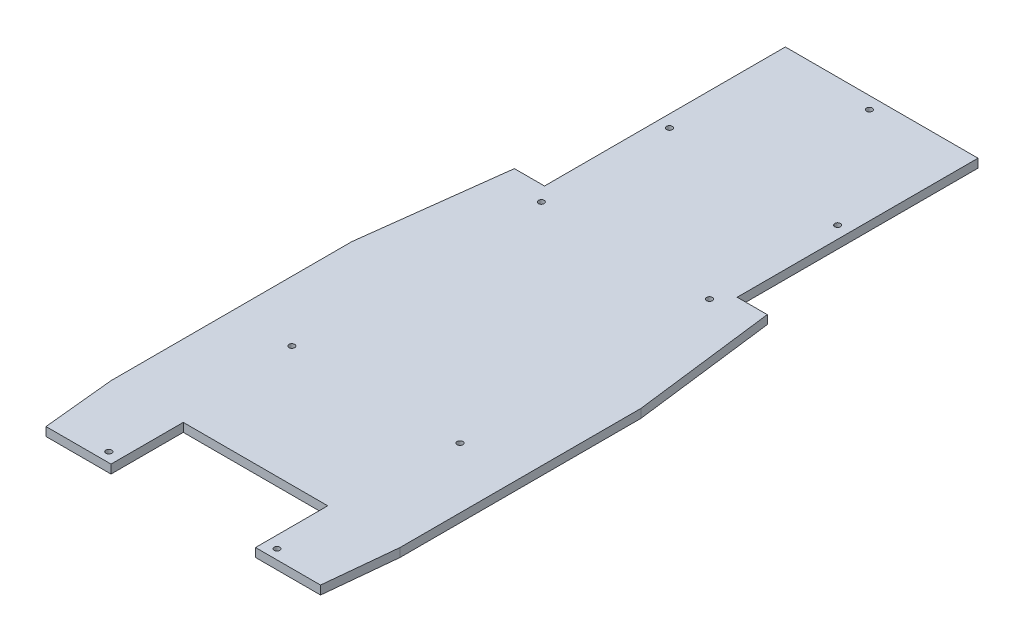
from build123d import *

# Parameters (mm, degrees)
BOSS_EXTRUDE1_DEPTH               = 9
F_6_0_6_DIAMETER_HOLE1_D          = 6
F_6_0_6_DIAMETER_HOLE3_D          = 6
F_6_0_6_DIAMETER_HOLE3_DEPTH      = 34.5
F_6_0_6_DIAMETER_HOLE3_TIP        = 1.802581857
F_6_0_6_DIAMETER_HOLE4_AT_2_COUNT = 2
F_6_0_6_DIAMETER_HOLE4_AT_2_PITCH = 246
F_6_0_6_DIAMETER_HOLE5_AT_2_COUNT = 2
F_6_0_6_DIAMETER_HOLE5_AT_2_PITCH = 56
F_6_0_6_DIAMETER_HOLE5_AT_3_COUNT = 2
F_6_0_6_DIAMETER_HOLE5_AT_3_PITCH = 164
F_6_0_6_DIAMETER_HOLE5_AT_4_COUNT = 2
F_6_0_6_DIAMETER_HOLE5_AT_4_PITCH = 173.297432179
CUT_EXTRUDE1_DEPTH                = 547.082411363


with BuildPart() as part:
    # Sketch1 → Boss-Extrude1 (new body)
    with BuildSketch(Plane(origin=(0, 0, 0), x_dir=(1, 0, 0), z_dir=(0, 1, 0))):
        Polygon((-150, -125), (-150, 125), (-100, 525), (100, 525), (150, 125), (150, -125), (125, -375), (-125, -375), align=None)
    extrude(amount=BOSS_EXTRUDE1_DEPTH)

    # Ø6.0 (6) Diameter Hole1 (through all)
    with Locations(Plane(origin=(0, 9, -512.3), x_dir=(0, 0, 1), z_dir=(0, 1, 0))):
        with Locations((0, 0), (120.3, -87.3), (253.3, -87.3), (253.3, 87.3), (120.3, 87.3), (512.3, 87.3), (512.3, -87.3), (702.3, -87.3), (702.3, 87.3), (799.1, 0)):
            Hole(F_6_0_6_DIAMETER_HOLE1_D / 2)

    # Ø6.0 (6) Diameter Hole3
    with Locations(Plane(origin=(0, 0, -512.3), x_dir=(0, 0, -1), z_dir=(0, -1, 0))):
        with Locations((0, 0), (-120.3, 87.3), (-120.3, -87.3), (-253.3, -87.3), (-253.3, 87.3), (-512.3, 87.3), (-512.3, -87.3), (-702.3, -87.3), (-702.3, 87.3), (-799.1, 0)):
            Hole(F_6_0_6_DIAMETER_HOLE3_D / 2, depth=F_6_0_6_DIAMETER_HOLE3_DEPTH)
            with Locations((0, 0, -(F_6_0_6_DIAMETER_HOLE3_DEPTH + F_6_0_6_DIAMETER_HOLE3_TIP / 2))):  # 118° drill point
                Cone(0, F_6_0_6_DIAMETER_HOLE3_D / 2, F_6_0_6_DIAMETER_HOLE3_TIP, mode=Mode.SUBTRACT)

    # Sketch10 → Ø6.0 (6) Diameter Hole4 (revolve, cut)
    with BuildSketch(Plane(origin=(123, 9, 311), x_dir=(0, 0, 1), z_dir=(1, 0, 0))):
        Polygon((0, 0), (0, 9), (6, 9), (3, 6), (3, 0), align=None)
    f_6_0_6_diameter_hole4 = revolve(axis=Axis((123, 15.35, 311), (0, -1, 0)), mode=Mode.SUBTRACT)

    # Ø6.0 (6) Diameter Hole4 at 2: Ø6.0 (6) Diameter Hole4 ×2
    with Locations(*[(-i * F_6_0_6_DIAMETER_HOLE4_AT_2_PITCH, 0, 0) for i in range(1, F_6_0_6_DIAMETER_HOLE4_AT_2_COUNT)]):
        add(f_6_0_6_diameter_hole4, mode=Mode.SUBTRACT)

    # Sketch12 → Ø6.0 (6) Diameter Hole5 (revolve, cut)
    with BuildSketch(Plane(origin=(-82, 9, 363.75), x_dir=(0, 0, 1), z_dir=(1, 0, 0))):
        Polygon((0, 0), (0, 9), (6, 9), (3, 6), (3, 0), align=None)
    f_6_0_6_diameter_hole5 = revolve(axis=Axis((-82, 15.35, 363.75), (0, -1, 0)), mode=Mode.SUBTRACT)

    # Ø6.0 (6) Diameter Hole5 at 2: Ø6.0 (6) Diameter Hole5 ×2
    with Locations(*[(0, 0, -i * F_6_0_6_DIAMETER_HOLE5_AT_2_PITCH) for i in range(1, F_6_0_6_DIAMETER_HOLE5_AT_2_COUNT)]):
        add(f_6_0_6_diameter_hole5, mode=Mode.SUBTRACT)

    # Ø6.0 (6) Diameter Hole5 at 3: Ø6.0 (6) Diameter Hole5 ×2
    with Locations(*[(i * F_6_0_6_DIAMETER_HOLE5_AT_3_PITCH, 0, 0) for i in range(1, F_6_0_6_DIAMETER_HOLE5_AT_3_COUNT)]):
        add(f_6_0_6_diameter_hole5, mode=Mode.SUBTRACT)

    # Ø6.0 (6) Diameter Hole5 at 4: Ø6.0 (6) Diameter Hole5 ×2
    with Locations(*[Vector(0.9463498560679912, 0, -0.32314385329152157) * (i * F_6_0_6_DIAMETER_HOLE5_AT_4_PITCH) for i in range(1, F_6_0_6_DIAMETER_HOLE5_AT_4_COUNT)]):
        add(f_6_0_6_diameter_hole5, mode=Mode.SUBTRACT)

    # Sketch13 → Cut-Extrude1 (cut, through all)
    with BuildSketch(Plane(origin=(0, 9, 0), x_dir=(1, 0, 0), z_dir=(0, 1, 0))):
        Polygon((-125, -375), (125, -375), (142.5, -200), (75, -200), (75, -125), (-75, -125), (-75, -200), (-142.5, -200), align=None)
        Polygon((-100, 525), (-100, 275), (-131.25, 275), align=None)
        Polygon((100, 525), (100, 275), (131.25, 275), align=None)
    extrude(amount=-CUT_EXTRUDE1_DEPTH, mode=Mode.SUBTRACT)


solid = part.part
